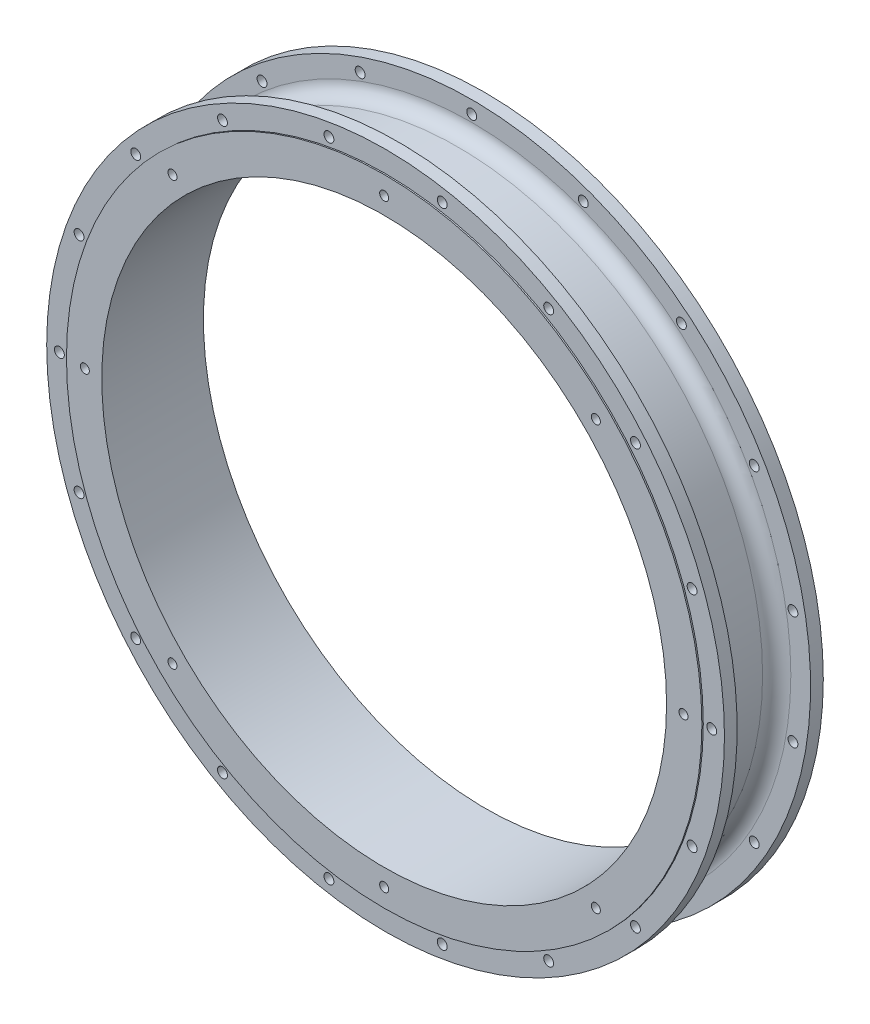
from build123d import *

# Parameters (mm, degrees)
SKETCH_1_R               = 120
EXTRUDE_1_DEPTH          = 35
SKETCH_9_R               = 112.5
EXTRUDE_2_DEPTH          = 0.5
EXTRUDE_START            = 0.5
SKETCH_6_R               = 112.5
EXTRUDE_3_DEPTH          = 0.5
CUT_EXTRUDE_2_DEPTH      = 174.378920287
CUT_EXTRUDE_2_DEPTH_BACK = 174.378920287
SKETCH_5_R               = 100
SKETCH_4_R               = 1.75
CUT_EXTRUDE_3_DEPTH      = 5
SKETCH_2_R               = 1.75
CUT_EXTRUDE_4_DEPTH      = 5
SKETCH_10_R              = 1.6
CUT_EXTRUDE_6_DEPTH      = 6
CUT_EXTRUDE_START        = 29.5
SKETCH_11_R              = 1.6
CUT_EXTRUDE_7_DEPTH      = 6.5


with BuildPart() as part:
    # Эскиз1 → Бобышка-Вытянуть1 (new body)
    with BuildSketch(Plane.XY):
        Circle(SKETCH_1_R)
    extrude(amount=EXTRUDE_1_DEPTH)

    # Эскиз7 → Вырез-Повернуть2 (revolve, cut)
    with BuildSketch(Plane(origin=(0, 0, 0), x_dir=(1, 0, 0), z_dir=(0, 1, 0))):
        with BuildLine():
            Line((-120, 0), (-120, -4.5))
            Line((-120, -4.5), (-113, -4.5))
            ThreePointArc((-113, -4.5), (-109.464466094, -5.964466094), (-108, -9.5))
            Line((-108, -9.5), (-108, -25.5))
            ThreePointArc((-108, -25.5), (-109.464466094, -29.035533906), (-113, -30.5))
            Line((-113, -30.5), (-120, -30.5))
            Line((-120, -30.5), (-120, -35))
            Line((-120, -35), (-128.220660741, -35))
            Line((-128.220660741, -35), (-128.220660741, 0))
            Line((-128.220660741, 0), (-120, 0))
        make_face()
    revolve(axis=Axis((0, 0, 0), (0, 0, 1)), mode=Mode.SUBTRACT)

    # Эскиз9 → Бобышка-Вытянуть2 (add)
    with BuildSketch(Plane.XY.offset(35)):
        Circle(SKETCH_9_R)
    extrude(amount=EXTRUDE_2_DEPTH)

    # Эскиз6 → Бобышка-Вытянуть3 (add)
    with BuildSketch(Plane(origin=(0, 0, 0), x_dir=(-1, 0, 0), z_dir=(0, 0, -1)).offset(EXTRUDE_START)):
        Circle(SKETCH_6_R)
    extrude(amount=-EXTRUDE_3_DEPTH)

    # Эскиз5 → Вырез-Вытянуть2 (cut, two sides: drawn at the far end of the back side and taken through both)
    with BuildSketch(Plane.XY.offset(35).offset(-CUT_EXTRUDE_2_DEPTH_BACK)):
        Circle(SKETCH_5_R)
    extrude(amount=CUT_EXTRUDE_2_DEPTH + CUT_EXTRUDE_2_DEPTH_BACK, mode=Mode.SUBTRACT)

    # Эскиз4 → Вырез-Вытянуть3 (cut)
    with BuildSketch(Plane.XY.offset(35)):
        with Locations((-115.5, 0)):
            Circle(SKETCH_4_R)
        with Locations((-108.534497701, 39.503326554)):
            Circle(SKETCH_4_R)
        with Locations((-88.47813318, 74.241968919)):
            Circle(SKETCH_4_R)
        with Locations((-57.75, 100.025934137)):
            Circle(SKETCH_4_R)
        with Locations((-20.056364521, 113.745295473)):
            Circle(SKETCH_4_R)
        with Locations((20.056364521, 113.745295473)):
            Circle(SKETCH_4_R)
        with Locations((57.75, 100.025934137)):
            Circle(SKETCH_4_R)
        with Locations((88.47813318, 74.241968919)):
            Circle(SKETCH_4_R)
        with Locations((108.534497701, 39.503326554)):
            Circle(SKETCH_4_R)
        with Locations((115.5, 0)):
            Circle(SKETCH_4_R)
        with Locations((108.534497701, -39.503326554)):
            Circle(SKETCH_4_R)
        with Locations((88.47813318, -74.241968919)):
            Circle(SKETCH_4_R)
        with Locations((57.75, -100.025934137)):
            Circle(SKETCH_4_R)
        with Locations((20.056364521, -113.745295473)):
            Circle(SKETCH_4_R)
        with Locations((-20.056364521, -113.745295473)):
            Circle(SKETCH_4_R)
        with Locations((-57.75, -100.025934137)):
            Circle(SKETCH_4_R)
        with Locations((-88.47813318, -74.241968919)):
            Circle(SKETCH_4_R)
        with Locations((-108.534497701, -39.503326554)):
            Circle(SKETCH_4_R)
    extrude(amount=-CUT_EXTRUDE_3_DEPTH, mode=Mode.SUBTRACT)

    # Эскиз2 → Вырез-Вытянуть4 (cut)
    with BuildSketch(Plane(origin=(0, 0, 0), x_dir=(-1, 0, 0), z_dir=(0, 0, -1))):
        with Locations((0, 115.5)):
            Circle(SKETCH_2_R)
        with Locations((39.503326554, 108.534497701)):
            Circle(SKETCH_2_R)
        with Locations((74.241968919, 88.47813318)):
            Circle(SKETCH_2_R)
        with Locations((100.025934137, 57.75)):
            Circle(SKETCH_2_R)
        with Locations((113.745295473, 20.056364521)):
            Circle(SKETCH_2_R)
        with Locations((113.745295473, -20.056364521)):
            Circle(SKETCH_2_R)
        with Locations((100.025934137, -57.75)):
            Circle(SKETCH_2_R)
        with Locations((74.241968919, -88.47813318)):
            Circle(SKETCH_2_R)
        with Locations((39.503326554, -108.534497701)):
            Circle(SKETCH_2_R)
        with Locations((0, -115.5)):
            Circle(SKETCH_2_R)
        with Locations((-39.503326554, -108.534497701)):
            Circle(SKETCH_2_R)
        with Locations((-74.241968919, -88.47813318)):
            Circle(SKETCH_2_R)
        with Locations((-100.025934137, -57.75)):
            Circle(SKETCH_2_R)
        with Locations((-113.745295473, -20.056364521)):
            Circle(SKETCH_2_R)
        with Locations((-113.745295473, 20.056364521)):
            Circle(SKETCH_2_R)
        with Locations((-100.025934137, 57.75)):
            Circle(SKETCH_2_R)
        with Locations((-74.241968919, 88.47813318)):
            Circle(SKETCH_2_R)
        with Locations((-39.503326554, 108.534497701)):
            Circle(SKETCH_2_R)
    extrude(amount=-CUT_EXTRUDE_4_DEPTH, mode=Mode.SUBTRACT)

    # Эскиз10 → Вырез-Вытянуть6 (cut)
    with BuildSketch(Plane(origin=(0, 0, -0.5), x_dir=(-1, 0, 0), z_dir=(0, 0, -1))):
        with Locations((0, 106)):
            Circle(SKETCH_10_R)
        with Locations((74.953318806, 74.953318806)):
            Circle(SKETCH_10_R)
        with Locations((106, 0)):
            Circle(SKETCH_10_R)
        with Locations((74.953318806, -74.953318806)):
            Circle(SKETCH_10_R)
        with Locations((0, -106)):
            Circle(SKETCH_10_R)
        with Locations((-74.953318806, -74.953318806)):
            Circle(SKETCH_10_R)
        with Locations((-106, 0)):
            Circle(SKETCH_10_R)
        with Locations((-74.953318806, 74.953318806)):
            Circle(SKETCH_10_R)
    extrude(amount=-CUT_EXTRUDE_6_DEPTH, mode=Mode.SUBTRACT)

    # Эскиз11 → Вырез-Вытянуть7 (cut)
    with BuildSketch(Plane.XY.offset(CUT_EXTRUDE_START)):
        with Locations((0, 106)):
            Circle(SKETCH_11_R)
        with Locations((74.953318806, 74.953318806)):
            Circle(SKETCH_11_R)
        with Locations((106, 0)):
            Circle(SKETCH_11_R)
        with Locations((74.953318806, -74.953318806)):
            Circle(SKETCH_11_R)
        with Locations((0, -106)):
            Circle(SKETCH_11_R)
        with Locations((-74.953318806, -74.953318806)):
            Circle(SKETCH_11_R)
        with Locations((-106, 0)):
            Circle(SKETCH_11_R)
        with Locations((-74.953318806, 74.953318806)):
            Circle(SKETCH_11_R)
    extrude(amount=CUT_EXTRUDE_7_DEPTH, mode=Mode.SUBTRACT)


solid = part.part
